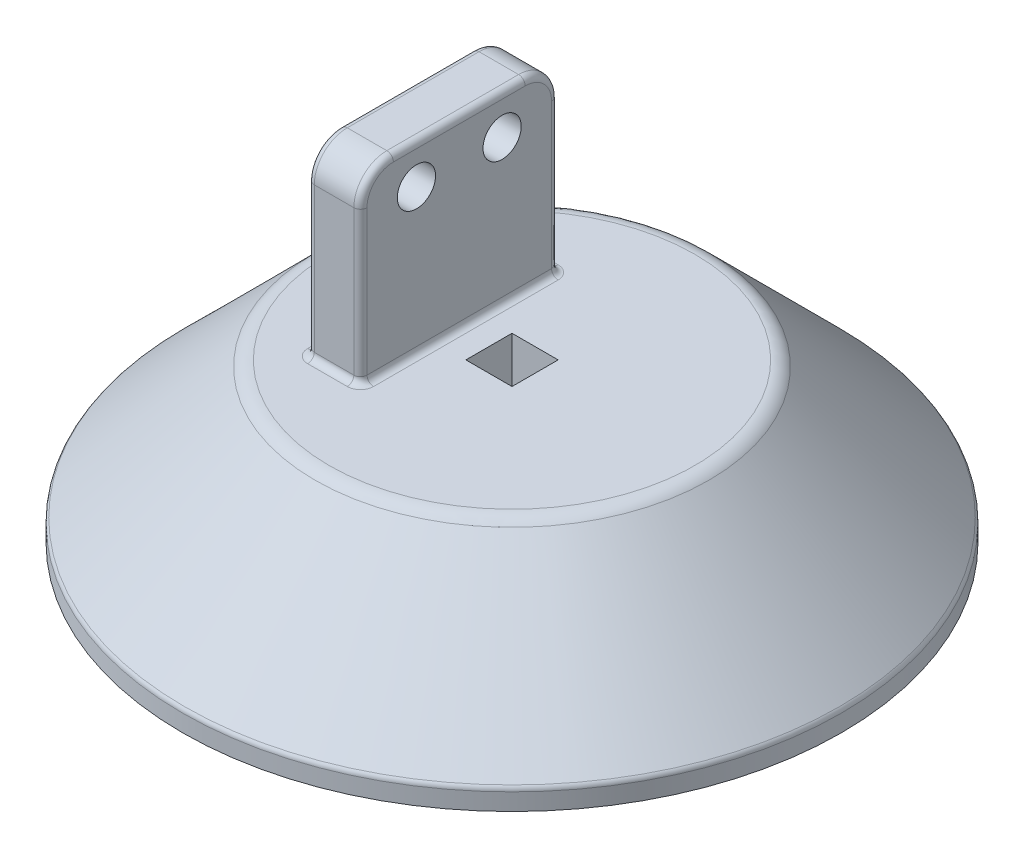
from build123d import *

# Parameters (mm, degrees)
SKETCH2_W           = 8
SKETCH2_H           = 30
BOSS_EXTRUDE1_DEPTH = 28
CUT_EXTRUDE1_REACH  = 89.772
SKETCH3_R           = 2.9
FILLET1_R           = 5
FILLET2_R           = 3
FILLET3_R           = 1
FILLET4_R           = 1
SKETCH4_W           = 7
SKETCH4_H           = 7
CUT_EXTRUDE2_DEPTH  = 20


with BuildPart() as part:
    # Sketch1 → Revolve1 (revolve)
    with BuildSketch(Plane.XY):
        Polygon((0, 0), (0, 24), (-29, 24), (-50, 3), (-50, 0), align=None)
    revolve(axis=Axis((0, 0, 0), (0, 1, 0)))

    # Sketch2 → Boss-Extrude1 (add)
    with BuildSketch(Plane(origin=(0, 24, 0), x_dir=(1, 0, 0), z_dir=(0, 1, 0))):
        with Locations((-12, 0)):
            Rectangle(SKETCH2_W, SKETCH2_H)
    extrude(amount=BOSS_EXTRUDE1_DEPTH)

    # Sketch3 → Cut-Extrude1 (cut, up to next)
    with BuildSketch(Plane(origin=(0, 0, 0), x_dir=(0, 0, -1), z_dir=(1, 0, 0)), mode=Mode.PRIVATE) as cut_extrude1_sk1:
        with Locations((-6.5, 46)):
            Circle(SKETCH3_R)
    cut_extrude1_tool1 = extrude(cut_extrude1_sk1.sketch, amount=-CUT_EXTRUDE1_REACH, mode=Mode.PRIVATE) & part.part
    # Sketch3 → Cut-Extrude1 (cut, up to next)
    with BuildSketch(Plane(origin=(0, 0, 0), x_dir=(0, 0, -1), z_dir=(1, 0, 0)), mode=Mode.PRIVATE) as cut_extrude1_sk2:
        with Locations((6.5, 46)):
            Circle(SKETCH3_R)
    cut_extrude1_tool2 = extrude(cut_extrude1_sk2.sketch, amount=-CUT_EXTRUDE1_REACH, mode=Mode.PRIVATE) & part.part
    add(cut_extrude1_tool1.solids().sort_by_distance((0, 46, 6.5))[0], mode=Mode.SUBTRACT)
    add(cut_extrude1_tool2.solids().sort_by_distance((0, 46, -6.5))[0], mode=Mode.SUBTRACT)

    # Fillet1
    fillet1_edges = [part.edges().sort_by_distance(p)[0] for p in [
        (-12, 52, -15),
        (-12, 52, 15),
    ]]
    fillet(fillet1_edges, radius=FILLET1_R)

    # Fillet2
    fillet2_edges = [part.edges().sort_by_distance(p)[0] for p in [
        (29, 24, 0),
    ]]
    fillet(fillet2_edges, radius=FILLET2_R)

    # Fillet3
    fillet3_edges = [part.edges().sort_by_distance(p)[0] for p in [
        (50, 3, 0),
    ]]
    fillet(fillet3_edges, radius=FILLET3_R)

    # Fillet4
    fillet4_edges = [part.edges().sort_by_distance(p)[0] for p in [
        (-16, 35.5, -15),
        (-16, 50.535533906, -13.535533906),
        (-16, 35.5, 15),
        (-16, 50.535533906, 13.535533906),
        (-8, 35.5, 15),
        (-8, 50.535533906, 13.535533906),
        (-8, 35.5, -15),
        (-8, 50.535533906, -13.535533906),
        (-16, 52, 0),
        (-8, 52, 0),
        (-12, 24, 15),
        (-8, 24, 0),
        (-12, 24, -15),
        (-16, 24, 0),
    ]]
    fillet(fillet4_edges, radius=FILLET4_R)

    # Sketch4 → Cut-Extrude2 (cut)
    with BuildSketch(Plane(origin=(0, 24, 0), x_dir=(1, 0, 0), z_dir=(0, 1, 0))):
        Rectangle(SKETCH4_W, SKETCH4_H)
    extrude(amount=-CUT_EXTRUDE2_DEPTH, mode=Mode.SUBTRACT)


solid = part.part
